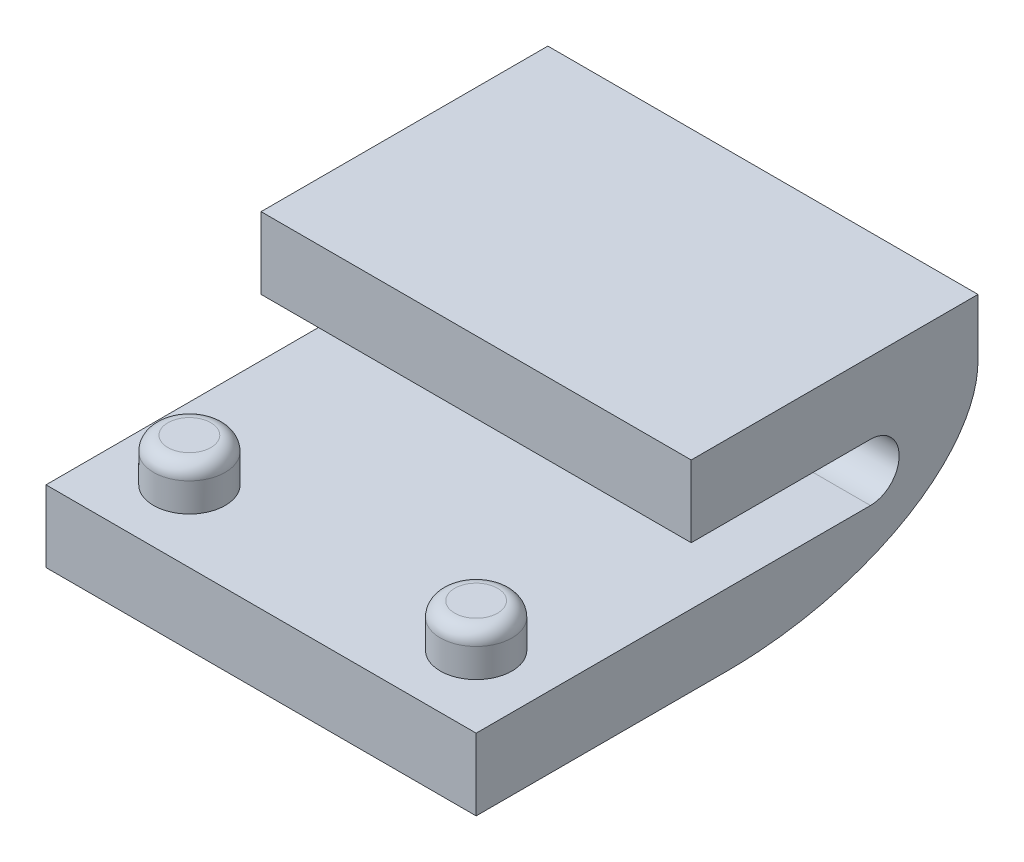
from build123d import *

# Parameters (mm, degrees)
RESSALTO_EXTRUS_O1_DEPTH = 3
FILETE1_SIZE             = 3.5
FILETE1_SIZE_2           = 2
ESBO_O2_R                = 0.5
RESSALTO_EXTRUS_O4_DEPTH = 0.6
ESBO_O3_R                = 0.5
RESSALTO_EXTRUS_O5_DEPTH = 0.4
FILETE2_R                = 0.2
FILETE2_OF_ESPELHAR1_R   = 0.2
ESBO_O4_R                = 0.4
CORTE_EXTRUS_O1_DEPTH    = 8.735632008


with BuildPart() as part:
    # Esboço1 → Ressalto-extrusão1 (new, symmetric)
    with BuildSketch(Plane(origin=(0, 0, 0), x_dir=(0, 0, -1), z_dir=(1, 0, 0))):
        Polygon((0, 0), (4, 0), (4, -2.8), (-3, -2.8), (-3, -1.8), (2.5, -1.8), (2.5, -1), (0, -1), align=None)
    extrude(amount=RESSALTO_EXTRUS_O1_DEPTH, both=True)

    # Filete1
    # an asymmetric fillet: 3.5, 2 mm, written as the material it takes off along each edge
    with BuildSketch(Plane(origin=(11.75, -2.8, -4), x_dir=(0, 0, 1), z_dir=(-1, 0, 0))) as filete1_piece_1:
        with BuildLine():
            Bezier((FILETE1_SIZE, 0), (0, 0), (0, FILETE1_SIZE_2), weights=[1, 0.707106781, 1])
            Line((0, FILETE1_SIZE_2), (0, 0))
            Line((0, 0), (FILETE1_SIZE, 0))
        make_face()
    extrude(amount=23.5, mode=Mode.SUBTRACT)

    # Esboço2 → Ressalto-extrusão4 (add)
    with BuildSketch(Plane(origin=(0, -1.8, 0), x_dir=(1, 0, 0), z_dir=(0, 1, 0))):
        with Locations(Location((-2, -2, 0), (0, 0, 90))):
            Circle(ESBO_O2_R)
    ressalto_extrus_o4 = extrude(amount=RESSALTO_EXTRUS_O4_DEPTH)

    # Esboço3 → Ressalto-extrusão5 (add)
    with BuildSketch(Plane.XZ.offset(1)):
        with Locations(Location((-2, -1, 0), (0, 0, 90))):
            Circle(ESBO_O3_R)
    ressalto_extrus_o5 = extrude(amount=RESSALTO_EXTRUS_O5_DEPTH)

    # Filete2
    filete2_edges = [part.edges().sort_by_distance(p)[0] for p in [
        (-2, -1.2, 2.5),
        (-2, -1.4, -1.5),
    ]]
    fillet(filete2_edges, radius=FILETE2_R)

    # Espelhar1: Ressalto-extrusão4, Ressalto-extrusão5 across plane
    add(ressalto_extrus_o4.mirror(Plane(origin=(0, 0, 0), x_dir=(0, 0, 1), z_dir=(1, 0, 0))))
    add(ressalto_extrus_o5.mirror(Plane(origin=(0, 0, 0), x_dir=(0, 0, 1), z_dir=(1, 0, 0))))

    # Filete2 of Espelhar1
    filete2_of_espelhar1_edges = [part.edges().sort_by_distance(p)[0] for p in [
        (2, -1.2, 2.5),
        (2, -1.4, -1.5),
    ]]
    fillet(filete2_of_espelhar1_edges, radius=FILETE2_OF_ESPELHAR1_R)

    # Esboço4 → Corte-extrusão1 (cut, through all)
    with BuildSketch(Plane.ZY.offset(3)):
        with Locations((-2.5, -1.4)):
            Circle(ESBO_O4_R)
    extrude(amount=-CORTE_EXTRUS_O1_DEPTH, mode=Mode.SUBTRACT)


solid = part.part
